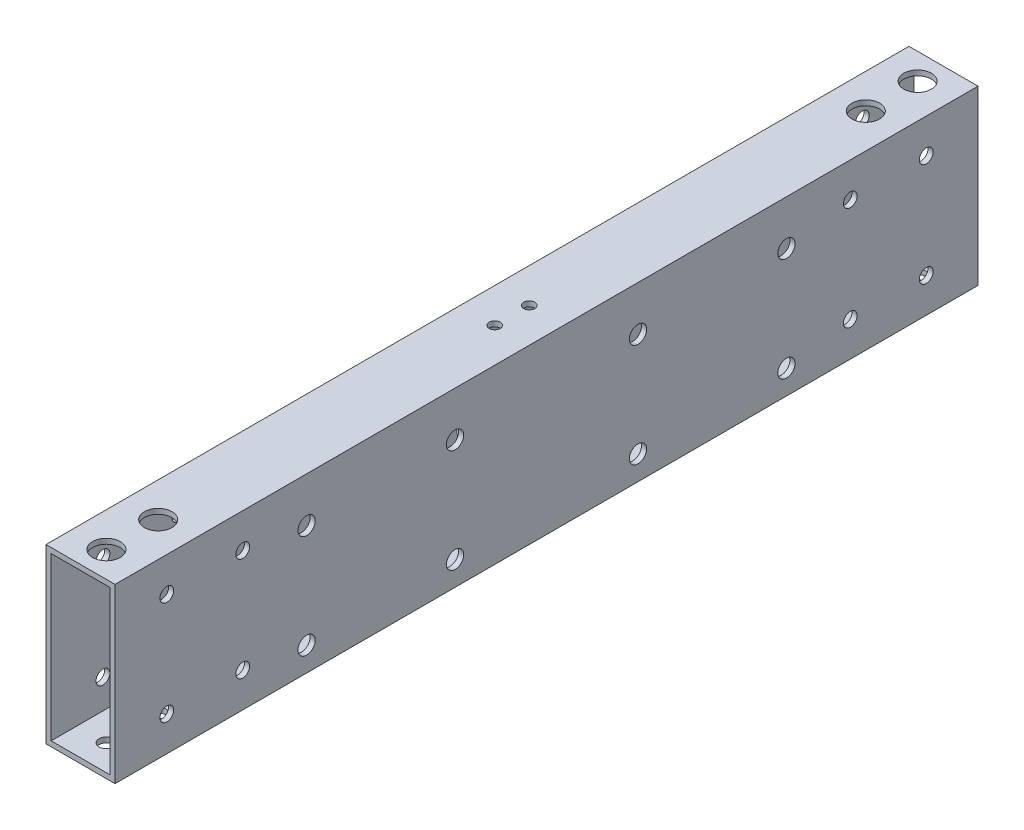
from build123d import *

# Parameters (mm, degrees)
SKETCH_1_W          = 20
SKETCH_1_H          = 50
SKETCH_1_W_2        = 17
SKETCH_1_H_2        = 47
EXTRUDE_1_DEPTH     = 250
SKETCH_2_R          = 2.5
CUT_EXTRUDE_1_DEPTH = 253.041663223
SKETCH_3_R          = 2.1
CUT_EXTRUDE_2_DEPTH = 256.147016443
SKETCH_4_R          = 1.6
CUT_EXTRUDE_3_DEPTH = 10
SKETCH_5_R          = 4
CUT_EXTRUDE_4_DEPTH = 10
SKETCH_6_R          = 7.5
CUT_EXTRUDE_5_DEPTH = 10
SKETCH_7_R          = 2
CUT_EXTRUDE_6_DEPTH = 253.041663223


with BuildPart() as part:
    # 草图1 → 凸台-拉伸1 (new body)
    with BuildSketch(Plane.XY):
        Rectangle(SKETCH_1_W, SKETCH_1_H)
        Rectangle(SKETCH_1_W_2, SKETCH_1_H_2, mode=Mode.SUBTRACT)
    extrude(amount=-EXTRUDE_1_DEPTH)

    # 草图2 → 切除-拉伸1 (cut, through all)
    with BuildSketch(Plane.ZY.offset(10)):
        with Locations((-55.5, 12)):
            Circle(SKETCH_2_R)
        with Locations((-98.5, 12)):
            Circle(SKETCH_2_R)
        with Locations((-98.5, -18)):
            Circle(SKETCH_2_R)
        with Locations((-55.5, -18)):
            Circle(SKETCH_2_R)
        with Locations((-194.5, -18)):
            Circle(SKETCH_2_R)
        with Locations((-151.5, -18)):
            Circle(SKETCH_2_R)
        with Locations((-151.5, 12)):
            Circle(SKETCH_2_R)
        with Locations((-194.5, 12)):
            Circle(SKETCH_2_R)
    extrude(amount=-CUT_EXTRUDE_1_DEPTH, mode=Mode.SUBTRACT)

    # 草图3 → 切除-拉伸2 (cut, through all)
    with BuildSketch(Plane(origin=(0, 25, 0), x_dir=(1, 0, 0), z_dir=(0, 1, 0))):
        with Locations((0, 22.5)):
            Circle(SKETCH_3_R)
        with Locations((0, 7.5)):
            Circle(SKETCH_3_R)
        with Locations((0, 242.5)):
            Circle(SKETCH_3_R)
        with Locations((0, 227.5)):
            Circle(SKETCH_3_R)
    extrude(amount=-CUT_EXTRUDE_2_DEPTH, mode=Mode.SUBTRACT)

    # 草图4 → 切除-拉伸3 (cut)
    with BuildSketch(Plane(origin=(0, 25, 0), x_dir=(1, 0, 0), z_dir=(0, 1, 0))):
        with Locations((0, 130)):
            Circle(SKETCH_4_R)
        with Locations((0, 120)):
            Circle(SKETCH_4_R)
    extrude(amount=-CUT_EXTRUDE_3_DEPTH, mode=Mode.SUBTRACT)

    # 草图5 → 切除-拉伸4 (cut)
    with BuildSketch(Plane(origin=(0, 25, 0), x_dir=(1, 0, 0), z_dir=(0, 1, 0))):
        with Locations((0, 22.5)):
            Circle(SKETCH_5_R)
        with Locations((0, 7.5)):
            Circle(SKETCH_5_R)
        with Locations((0, 242.5)):
            Circle(SKETCH_5_R)
        with Locations((0, 227.5)):
            Circle(SKETCH_5_R)
    extrude(amount=-CUT_EXTRUDE_4_DEPTH, mode=Mode.SUBTRACT)

    # 草图6 → 切除-拉伸5 (cut)
    with BuildSketch(Plane.ZY.offset(10)):
        with Locations((-125, -4)):
            Circle(SKETCH_6_R)
    extrude(amount=-CUT_EXTRUDE_5_DEPTH, mode=Mode.SUBTRACT)

    # 草图7 → 切除-拉伸6 (cut, through all)
    with BuildSketch(Plane.ZY.offset(10)):
        with Locations((-235, 15)):
            Circle(SKETCH_7_R)
        with Locations((-213, 15)):
            Circle(SKETCH_7_R)
        with Locations((-235, -15)):
            Circle(SKETCH_7_R)
        with Locations((-213, -15)):
            Circle(SKETCH_7_R)
        with Locations((-37, -15)):
            Circle(SKETCH_7_R)
        with Locations((-15, -15)):
            Circle(SKETCH_7_R)
        with Locations((-37, 15)):
            Circle(SKETCH_7_R)
        with Locations((-15, 15)):
            Circle(SKETCH_7_R)
    extrude(amount=-CUT_EXTRUDE_6_DEPTH, mode=Mode.SUBTRACT)


solid = part.part
